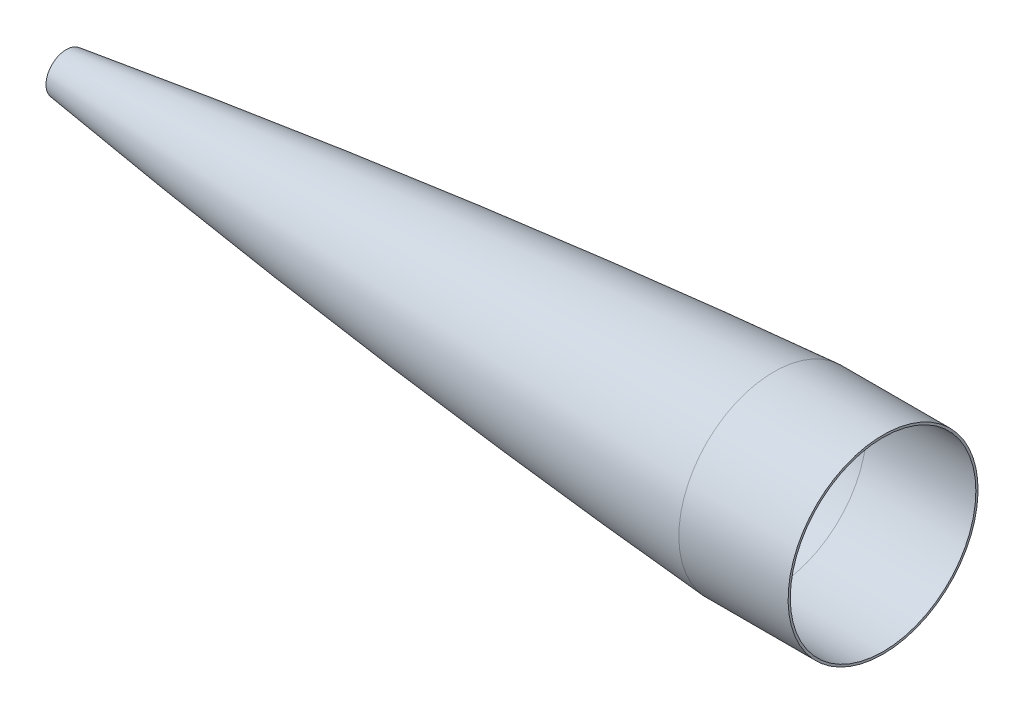
from build123d import *

# Parameters (mm, degrees)
SKETCH14_W         = 99.852899645
SKETCH14_H         = 2
CUT_EXTRUDE1_DEPTH = 50


with BuildPart() as part:
    # Sketch1 → Revolve1 (revolve)
    with BuildSketch(Plane(origin=(0, 0, 0), x_dir=(-1, 0, 0), z_dir=(0, 0, -1))):
        with BuildLine():
            Line((-763.382394472, 85), (-763.235294117, 85))
            ThreePointArc((-763.235294117, 85), (-380.825050597, 49.616912867), (0, 0))
            Line((0, 0), (18.46847438, 0))
            Line((18.46847438, 0), (0.295326728, 1.978075358))
            ThreePointArc((0.295326728, 1.978075358), (-380.640283603, 51.608700281), (-763.161647781, 87))
            Line((-763.161647781, 87), (-763.382394472, 87))
            Line((-763.382394472, 87), (-763.382394472, 85))
        make_face()
    revolve(axis=Axis((763.235294117, 0, 0), (-1, 0, 0)))

    # Sketch14 → Revolve4 (revolve)
    with BuildSketch(Plane(origin=(0, 0, 0), x_dir=(-1, 0, 0), z_dir=(0, 0, -1))):
        with Locations((-813.308844295, 86)):
            Rectangle(SKETCH14_W, SKETCH14_H)
    revolve(axis=Axis((763.235294117, 0, 0), (1, 0, 0)))

    # Sketch15 → Cut-Extrude1 (cut, symmetric)
    with BuildSketch(Plane.XY):
        Polygon((114.997091286, -36.098631976), (114.997091286, 0), (114.997091286, 42.308767364), (-24.793740749, 42.308767364), (-24.793740749, -36.098631976), align=None)
    extrude(amount=CUT_EXTRUDE1_DEPTH, both=True, mode=Mode.SUBTRACT)


solid = part.part
